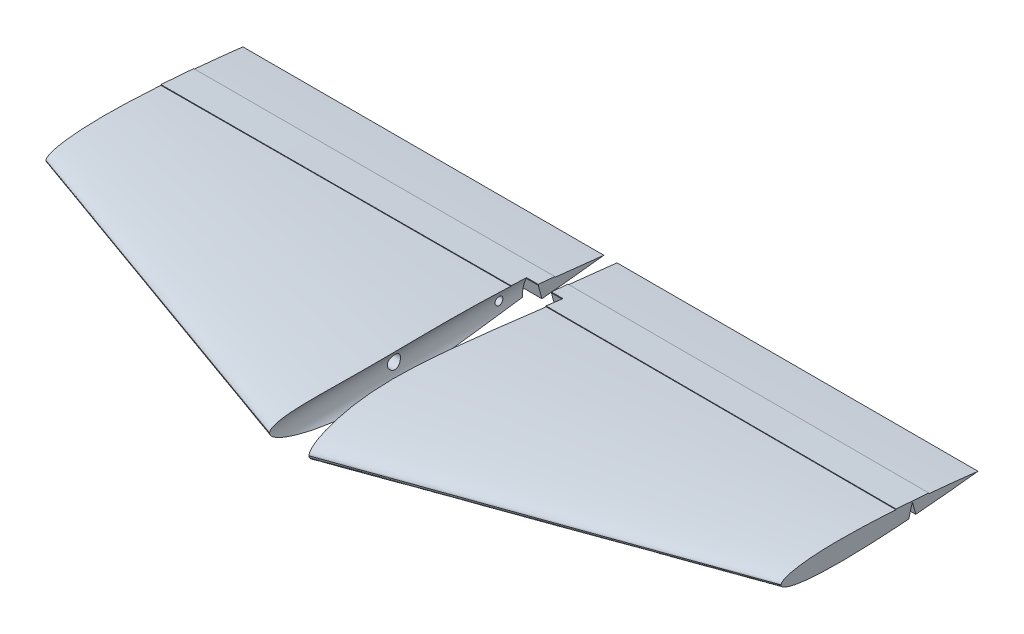
from build123d import *

# Parameters (mm, degrees)
CUT_EXTRUDE7_START      = -376.574578308
SKETCH17_W              = 44
SKETCH17_H              = 44
CUT_EXTRUDE7_DEPTH      = 381.574578308
SKETCH8_R               = 3
CUT_EXTRUDE10_DEPTH     = 100
SKETCH18_R              = 5
CUT_EXTRUDE11_DEPTH     = 150
SKETCH13_R              = 15
CUT_EXTRUDE5_DEPTH      = 345.320002122
CUT_EXTRUDE6_DEPTH      = 373.025016116
CUT_EXTRUDE6_DEPTH_BACK = 373.025016116
SKETCH14_W              = 10
SKETCH14_H              = 75


with BuildPart() as part:
    # Sketch3 → Loft1 section 0
    with BuildSketch(Plane(origin=(0, 0, 0), x_dir=(0, 0, -1), z_dir=(1, 0, 0))):
        with BuildLine():
            add(Edge.make_bspline(
                [(-250, 0), (-249.999895281, 0.195763361), (-249.961151424, 0.603923402), (-249.75955923, 1.263250946), (-249.128153903, 2.239806839), (-248.109823795, 3.175235862), (-246.576102635, 4.182773144), (-244.127109162, 5.366692622), (-240.073872734, 6.817923154), (-232.840047676, 8.611288496), (-221.29446773, 10.449653683), (-205.80771311, 11.81775272), (-187.49226418, 12.532505163), (-167.615673922, 12.562370188), (-147.96130587, 12.104155942), (-127.983093335, 11.220881059), (-108.565528946, 10.107332464), (-88.272495474, 8.647865064), (-69.457807346, 7.164126414), (-48.249165687, 5.205040487), (-31.044142862, 3.54737405), (-13.203762803, 1.558807082), (-4.467222804, 0.541092362), (0, 0)],
                knots=[0, 0, 0, 0, 0, 0.0027914, 0.005882719, 0.009734657, 0.016522403, 0.022438151, 0.032158027, 0.04863424, 0.078248652, 0.129036717, 0.199997011, 0.270957307, 0.341917602, 0.412877898, 0.483838194, 0.554798491, 0.625758787, 0.696719083, 0.767679379, 0.838639675, 0.909599973, 0.909599973, 0.909599973, 0.909599973, 0.909599973], degree=4))
            add(Edge.make_bspline(
                [(-250, 0), (-249.999895281, -0.195763361), (-249.961151424, -0.603923402), (-249.75955923, -1.263250946), (-249.128153903, -2.239806839), (-248.109823795, -3.175235862), (-246.576102635, -4.182773144), (-244.127109162, -5.366692622), (-240.073872734, -6.817923154), (-232.840047676, -8.611288496), (-221.29446773, -10.449653683), (-205.80771311, -11.81775272), (-187.49226418, -12.532505163), (-167.615673922, -12.562370188), (-147.96130587, -12.104155942), (-127.983093335, -11.220881059), (-108.565528946, -10.107332464), (-88.272495474, -8.647865064), (-69.457807346, -7.164126414), (-48.249165687, -5.205040487), (-31.044142862, -3.54737405), (-13.203762803, -1.558807082), (-4.467222803, -0.541092362), (0, 0)],
                knots=[0, 0, 0, 0, 0, 0.0027914, 0.005882719, 0.009734657, 0.016522403, 0.022438151, 0.032158027, 0.04863424, 0.078248652, 0.129036717, 0.199997011, 0.270957307, 0.341917602, 0.412877898, 0.483838194, 0.554798491, 0.625758787, 0.696719083, 0.767679379, 0.838639675, 0.909599973, 0.909599973, 0.909599973, 0.909599973, 0.909599973], degree=4))
        make_face()
    # Sketch4 → Loft1 section 1
    with BuildSketch(Plane(origin=(280, 0, 0), x_dir=(0, 0, -1), z_dir=(1, 0, 0))):
        with BuildLine():
            add(Edge.make_bspline(
                [(-150, 0), (-149.999937168, 0.117458016), (-149.976690854, 0.362354041), (-149.855735538, 0.757950568), (-149.476892342, 1.343884103), (-148.865894277, 1.905141517), (-147.945661581, 2.509663886), (-146.476265497, 3.220015573), (-144.04432364, 4.090753893), (-139.704028605, 5.166773097), (-132.776680638, 6.26979221), (-123.484627866, 7.090651632), (-112.495358508, 7.519503098), (-100.569404353, 7.537422113), (-88.776783522, 7.262493565), (-76.789856001, 6.732528635), (-65.139317368, 6.064399479), (-52.963497284, 5.188719038), (-41.674684407, 4.298475849), (-28.949499412, 3.123024292), (-18.626485717, 2.12842443), (-7.922257682, 0.935284249), (-2.680333682, 0.324655417), (0, 0)],
                knots=[0, 0, 0, 0, 0, 0.0027914, 0.005882719, 0.009734657, 0.016522403, 0.022438151, 0.032158027, 0.04863424, 0.078248652, 0.129036717, 0.199997011, 0.270957307, 0.341917602, 0.412877898, 0.483838194, 0.554798491, 0.625758787, 0.696719083, 0.767679379, 0.838639675, 0.909599973, 0.909599973, 0.909599973, 0.909599973, 0.909599973], degree=4))
            add(Edge.make_bspline(
                [(-150, 0), (-149.999937169, -0.117458016), (-149.976690854, -0.362354041), (-149.855735538, -0.757950568), (-149.476892342, -1.343884103), (-148.865894277, -1.905141517), (-147.945661581, -2.509663886), (-146.476265497, -3.220015573), (-144.04432364, -4.090753893), (-139.704028605, -5.166773097), (-132.776680638, -6.26979221), (-123.484627866, -7.090651632), (-112.495358508, -7.519503098), (-100.569404353, -7.537422113), (-88.776783522, -7.262493565), (-76.789856001, -6.732528635), (-65.139317368, -6.064399479), (-52.963497285, -5.188719038), (-41.674684407, -4.298475849), (-28.949499412, -3.123024292), (-18.626485717, -2.12842443), (-7.922257682, -0.935284249), (-2.680333682, -0.324655417), (0, 0)],
                knots=[0, 0, 0, 0, 0, 0.0027914, 0.005882719, 0.009734657, 0.016522403, 0.022438151, 0.032158027, 0.04863424, 0.078248652, 0.129036717, 0.199997011, 0.270957307, 0.341917602, 0.412877898, 0.483838194, 0.554798491, 0.625758787, 0.696719083, 0.767679379, 0.838639675, 0.909599973, 0.909599973, 0.909599973, 0.909599973, 0.909599973], degree=4))
        make_face()
    loft1 = loft()

    # Sketch6 → Cut-Loft1 section 0
    with BuildSketch(Plane.ZY):
        with BuildLine():
            Line((50, 5.222578378), (52.906464275, -5.624493968))
            Line((52.906464275, -5.624493968), (53.308388064, -7.124493968))
            Line((53.308388064, -7.124493968), (46.691611936, -7.124493968))
            Line((46.691611936, -7.124493968), (47.236267419, -5.091812034))
            Line((47.236267419, -5.091812034), (50, 5.222578378))
        make_face()
    # Sketch7 → Cut-Loft1 section 1
    with BuildSketch(Plane(origin=(280, 0, 0), x_dir=(0, 0, -1), z_dir=(1, 0, 0))):
        with BuildLine():
            Line((-50, 4.868494183), (-47.424974841, -4.741630539))
            Line((-47.424974841, -4.741630539), (-46.913435499, -6.650721356))
            Line((-46.913435499, -6.650721356), (-53.086564501, -6.650721356))
            Line((-53.086564501, -6.650721356), (-52.684640712, -5.150721356))
            Line((-52.684640712, -5.150721356), (-50, 4.868494183))
        make_face()
    cut_loft1 = loft(mode=Mode.SUBTRACT)

    # Sketch15 → Loft2 section 0
    with BuildSketch(Plane(origin=(280, 0, 0), x_dir=(0, 0, -1), z_dir=(1, 0, 0))):
        with BuildLine():
            Line((-62.5, 5.854103879), (-37.5, 3.899798493))
            Line((-37.5, 3.899798493), (-37.460913892, 4.399798493))
            Line((-37.460913892, 4.399798493), (-62.460913892, 6.354103879))
            Line((-62.460913892, 6.354103879), (-62.5, 5.854103879))
        make_face()
    # Sketch16 → Loft2 section 1
    with BuildSketch(Plane.ZY):
        with BuildLine():
            Line((37.435564177, 4.138141543), (62.435564177, 6.494023118))
            Line((62.435564177, 6.494023118), (62.388446545, 6.994023118))
            Line((62.388446545, 6.994023118), (37.388446545, 4.638141543))
            Line((37.388446545, 4.638141543), (37.435564177, 4.138141543))
        make_face()
    loft2 = loft()

    # Sketch17 → Cut-Extrude7 (cut)
    with BuildSketch(Plane(origin=(0, 0, 0), x_dir=(1, 0, 0), z_dir=(0, 1, 0)).offset(CUT_EXTRUDE7_START)):
        with Locations((62, -102)):
            Rectangle(SKETCH17_W, SKETCH17_H)
        with Locations((-62, -102)):
            Rectangle(SKETCH17_W, SKETCH17_H)
    cut_extrude7 = extrude(amount=CUT_EXTRUDE7_DEPTH, mode=Mode.SUBTRACT)

    # Sketch8 → Cut-Extrude10 (cut)
    with BuildSketch(Plane.ZY):
        with Locations((70, 0)):
            Circle(SKETCH8_R)
    cut_extrude10 = extrude(amount=-CUT_EXTRUDE10_DEPTH, mode=Mode.SUBTRACT)

    # Sketch18 → Cut-Extrude11 (cut)
    with BuildSketch(Plane(origin=(0, 0, 0), x_dir=(0, 0, -1), z_dir=(1, 0, 0))):
        with Locations((-150, 0)):
            Circle(SKETCH18_R)
    cut_extrude11 = extrude(amount=CUT_EXTRUDE11_DEPTH, mode=Mode.SUBTRACT)

    # Mirror7: Loft1, Cut-Loft1, Loft2, Cut-Extrude7, Cut-Extrude10, Cut-Extrude11 across plane
    add(loft1.mirror(Plane(origin=(0, 0, 0), x_dir=(0, 0, 1), z_dir=(1, 0, 0))))
    add(cut_loft1.mirror(Plane(origin=(0, 0, 0), x_dir=(0, 0, 1), z_dir=(1, 0, 0))), mode=Mode.SUBTRACT)
    add(loft2.mirror(Plane(origin=(0, 0, 0), x_dir=(0, 0, 1), z_dir=(1, 0, 0))))
    add(cut_extrude7.mirror(Plane(origin=(0, 0, 0), x_dir=(0, 0, 1), z_dir=(1, 0, 0))), mode=Mode.SUBTRACT)
    add(cut_extrude10.mirror(Plane(origin=(0, 0, 0), x_dir=(0, 0, 1), z_dir=(1, 0, 0))), mode=Mode.SUBTRACT)
    add(cut_extrude11.mirror(Plane(origin=(0, 0, 0), x_dir=(0, 0, 1), z_dir=(1, 0, 0))), mode=Mode.SUBTRACT)

    # Sketch13 → Cut-Extrude5 (cut, through all)
    with BuildSketch(Plane.XY.offset(50)):
        Circle(SKETCH13_R)
    extrude(amount=CUT_EXTRUDE5_DEPTH, mode=Mode.SUBTRACT)

    # Sketch14 → Cut-Extrude6 (cut, two sides: drawn at the far end of the back side and taken through both)
    with BuildSketch(Plane(origin=(0, 0, 0), x_dir=(1, 0, 0), z_dir=(0, 1, 0)).offset(-CUT_EXTRUDE6_DEPTH_BACK)):
        with Locations((0, -37.5)):
            Rectangle(SKETCH14_W, SKETCH14_H)
    extrude(amount=CUT_EXTRUDE6_DEPTH + CUT_EXTRUDE6_DEPTH_BACK, mode=Mode.SUBTRACT)


with BuildPart() as cut_extrude6_piece_1:
    # of the separate pieces the step leaves, piece 1, a body of its own (cut_extrude6_pieces)
    add(part.part.solids().sort_by_distance((-5, 5.216255446, 50))[0])


with BuildPart() as cut_extrude6_piece_2:
    # of the separate pieces the step leaves, piece 2, a body of its own (cut_extrude6_pieces)
    add(part.part.solids().sort_by_distance((15, 0, 244.642857143))[0])


solid = Compound([cut_extrude6_piece_1.part, cut_extrude6_piece_2.part])
